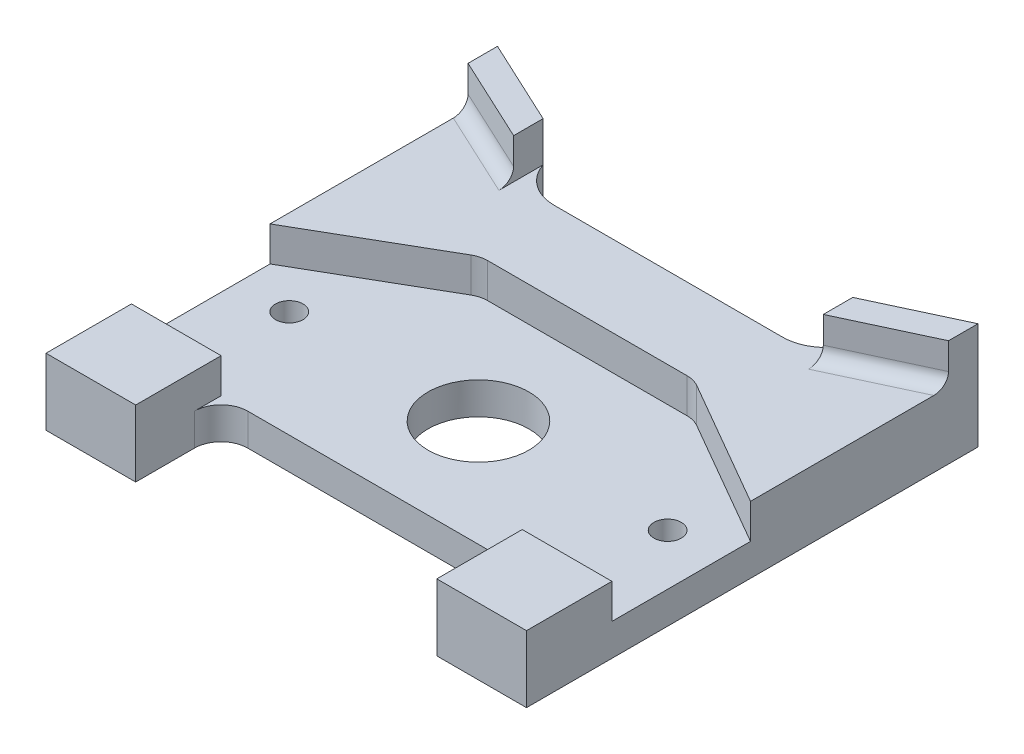
from build123d import *

# Parameters (mm, degrees)
SKETCH1_W             = 57.15
SKETCH1_H             = 25.4
BOSS_EXTRUDE1_DEPTH   = 3.81
CUT_EXTRUDE1_REACH    = 33.501
SKETCH2_R             = 6
F_4_CLEARANCE_HOLE1_D = 3.2639
BOSS_EXTRUDE4_DEPTH   = 3.81
BOSS_EXTRUDE5_DEPTH   = 8.89
SKETCH12_W            = 36.83
SKETCH12_H            = 9.899955096
BOSS_EXTRUDE6_DEPTH   = 3.81
BOSS_EXTRUDE7_DEPTH   = 4.1275
FILLET4_R             = 3.175
FILLET5_R             = 1.5875
BOSS_EXTRUDE8_REACH   = 45.92
SKETCH14_W            = 10.668
SKETCH14_H            = 10.16
FILLET6_R             = 3.175
FILLET7_R             = 5.08


with BuildPart() as part:
    # Sketch1 → Boss-Extrude1 (new body)
    with BuildSketch(Plane(origin=(0, 0, 0), x_dir=(1, 0, 0), z_dir=(0, 1, 0))):
        Rectangle(SKETCH1_W, SKETCH1_H)
    extrude(amount=BOSS_EXTRUDE1_DEPTH)

    # Sketch2 → Cut-Extrude1 (cut, up to next)
    with BuildSketch(Plane(origin=(0, 3.81, 0), x_dir=(1, 0, 0), z_dir=(0, 1, 0)), mode=Mode.PRIVATE) as cut_extrude1_sk1:
        with Locations(Location((0, 0, 0), (0, 0, 270))):
            Circle(SKETCH2_R)
    cut_extrude1_tool1 = extrude(cut_extrude1_sk1.sketch, amount=-CUT_EXTRUDE1_REACH, mode=Mode.PRIVATE) & part.part
    add(cut_extrude1_tool1.solids().sort_by_distance((0, 3.81, 0))[0], mode=Mode.SUBTRACT)

    # #4 Clearance Hole1 (through all)
    with Locations(Plane(origin=(0, 3.81, 0), x_dir=(1, 0, 0), z_dir=(0, 1, 0))):
        with Locations((-22.5, 0), (22.5, 0)):
            Hole(F_4_CLEARANCE_HOLE1_D / 2)

    # Sketch8 → Boss-Extrude4 (add)
    with BuildSketch(Plane(origin=(0, 3.81, 0), x_dir=(1, 0, 0), z_dir=(0, 1, 0))):
        Polygon((-28.575, 30.840865795), (-28.575, 12.7), (-18.415, 12.7), (-18.415, 26.103179988), align=None)
    boss_extrude4 = extrude(amount=-BOSS_EXTRUDE4_DEPTH)

    # Mirror4: Boss-Extrude4 across plane
    add(boss_extrude4.mirror(Plane(origin=(0, 0, 0), x_dir=(0, 0, 1), z_dir=(1, 0, 0))))

    # Sketch11 → Boss-Extrude5 (add)
    with BuildSketch(Plane(origin=(0, 3.81, 0), x_dir=(1, 0, 0), z_dir=(0, 1, 0))):
        Polygon((-18.415, 26.103179988), (-28.575, 30.840865795), (-28.575, 27.337640903), (-18.415, 22.599955096), align=None)
    boss_extrude5 = extrude(amount=BOSS_EXTRUDE5_DEPTH)

    # Mirror7: Boss-Extrude5 across plane
    add(boss_extrude5.mirror(Plane(origin=(0, 0, 0), x_dir=(0, 0, 1), z_dir=(1, 0, 0))))

    # Sketch12 → Boss-Extrude6 (add)
    with BuildSketch(Plane(origin=(0, 3.81, 0), x_dir=(1, 0, 0), z_dir=(0, 1, 0))):
        with Locations((0, 17.649977548)):
            Rectangle(SKETCH12_W, SKETCH12_H)
    extrude(amount=-BOSS_EXTRUDE6_DEPTH)

    # Sketch13 → Boss-Extrude7 (add)
    with BuildSketch(Plane(origin=(0, 3.81, 0), x_dir=(1, 0, 0), z_dir=(0, 1, 0))):
        Polygon((12.7, 12.947955096), (-12.7, 12.947955096), (-28.575, 3.782519572), (-28.575, 27.337640903), (-18.415, 22.599955096), (18.415, 22.599955096), (28.575, 27.337640903), (28.575, 3.782519572), align=None)
    extrude(amount=BOSS_EXTRUDE7_DEPTH)

    # Fillet4
    fillet4_edges = [part.edges().sort_by_distance(p)[0] for p in [
        (-12.7, 5.87375, -12.947955096),
        (12.7, 5.87375, -12.947955096),
    ]]
    fillet(fillet4_edges, radius=FILLET4_R)

    # Fillet5
    fillet5_edges = [part.edges().sort_by_distance(p)[0] for p in [
        (23.495, 7.9375, -24.968797999),
        (-23.495, 7.9375, -24.968797999),
    ]]
    fillet(fillet5_edges, radius=FILLET5_R)

    # Boss-Extrude8: up to this face of the body (flat: up to its plane)
    boss_extrude8_end = Plane(part.part.faces().sort_by_distance((0, 7.9375, -16.275006061))[0])
    # Sketch14 → Boss-Extrude8 (add, up to the picked face)
    with BuildSketch(Plane(origin=(0, 0, 0), x_dir=(1, 0, 0), z_dir=(0, 1, 0)), mode=Mode.PRIVATE) as boss_extrude8_sk1:
        with Locations((23.241, -17.78)):
            Rectangle(SKETCH14_W, SKETCH14_H)
    boss_extrude8_tool1 = split(extrude(boss_extrude8_sk1.sketch, amount=BOSS_EXTRUDE8_REACH, mode=Mode.PRIVATE), bisect_by=boss_extrude8_end, keep=Keep.BOTH, mode=Mode.PRIVATE)
    boss_extrude8 = boss_extrude8_tool1.solids().sort_by(Axis((23.241, 0, 17.78), (0, 1, 0)))[0]
    add(boss_extrude8)

    # Mirror9: Boss-Extrude8 across plane
    add(boss_extrude8.mirror(Plane(origin=(0, 0, 0), x_dir=(0, 0, 1), z_dir=(1, 0, 0))))

    # Fillet6
    fillet6_edges = [part.edges().sort_by_distance(p)[0] for p in [
        (17.907, 1.905, 12.7),
        (-17.907, 1.905, 12.7),
    ]]
    fillet(fillet6_edges, radius=FILLET6_R)

    # Fillet7
    # the kernel refuses this fillet: 5.08 mm, written as the material it adds along each edge
    with BuildSketch(Plane(origin=(-18.415, 0, -22.599955096), x_dir=(0, 0, -1), z_dir=(0, 1, 0))) as fillet7_piece_1:
        with BuildLine():
            CenterArc((5.08, -4.829097251), FILLET7_R, 108.082662978, 71.917337022)
            Line((0, -4.829097251), (-0.1016, -4.829097251))
            Line((-0.1016, -4.829097251), (-0.1016, 0))
            Line((-0.1016, 0), (0, 0.1016))
            ThreePointArc((0, 0.1016), (1.751612446, 0.1016), (3.471689391, 0.096581945))
            Line((3.471689391, 0.096581945), (3.503224893, 0))
        make_face()
    extrude(amount=7.9375)
    with BuildSketch(Plane(origin=(18.415, 0, -22.599955096), x_dir=(0, 0, -1), z_dir=(0, 1, 0))) as fillet7_piece_2:
        with BuildLine():
            CenterArc((5.08, 4.829097251), FILLET7_R, 180, 71.917337022)
            Line((0, 4.829097251), (-0.1016, 4.829097251))
            Line((-0.1016, 4.829097251), (-0.1016, 0))
            Line((-0.1016, 0), (0, -0.1016))
            ThreePointArc((0, -0.1016), (1.751612446, -0.1016), (3.471689391, -0.096581945))
            Line((3.471689391, -0.096581945), (3.503224893, 0))
        make_face()
    extrude(amount=7.9375)


solid = part.part
